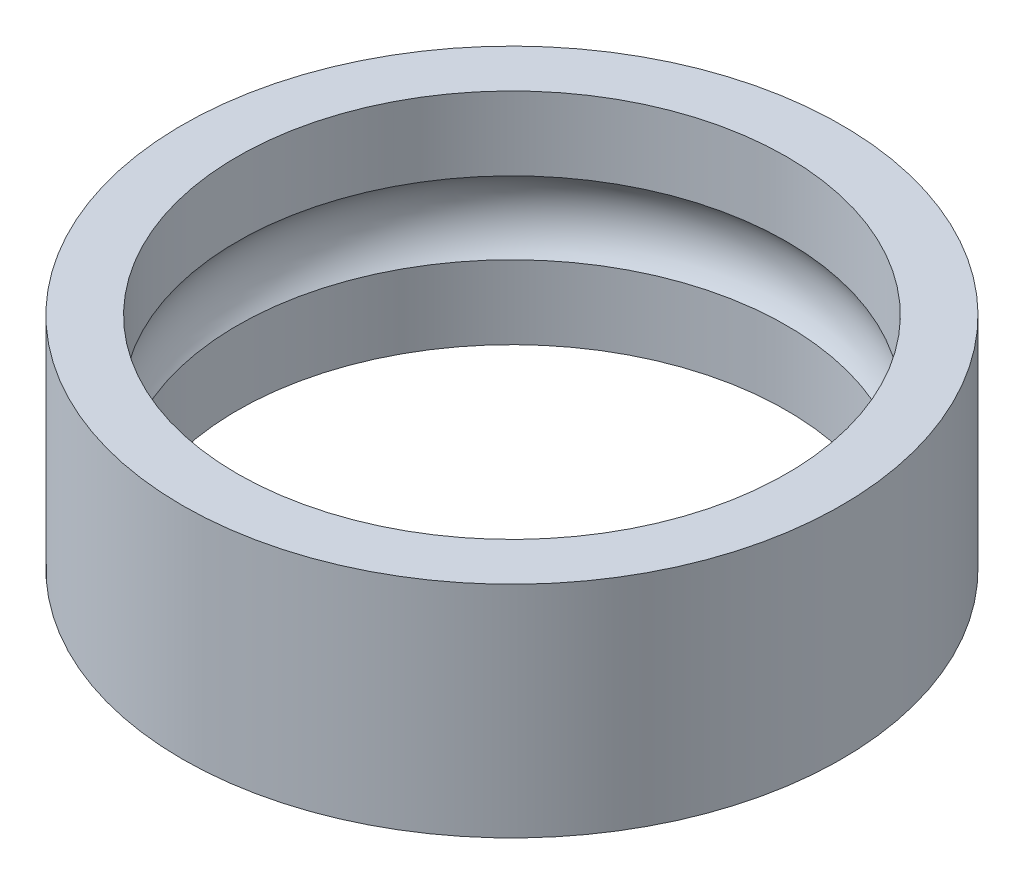
from build123d import *

# Parameters (mm, degrees)
DIAPROFILES_R         = 3
DIAPROFILES_R_2       = 2.5
DIAPROFILE_DEPTH      = 1
BEARINGPATHPROFILES_R = 0.5


with BuildPart() as part:
    # DiaProfileS → DiaProfile (new, symmetric)
    with BuildSketch(Plane(origin=(0, 0, 0), x_dir=(1, 0, 0), z_dir=(0, 1, 0))):
        Circle(DIAPROFILES_R)
        Circle(DIAPROFILES_R_2, mode=Mode.SUBTRACT)
    extrude(amount=DIAPROFILE_DEPTH, both=True)

    # BearingPathProfileS → BearingPathProfile (revolve, cut)
    with BuildSketch(Plane.XY):
        with Locations((2.125, 0)):
            Circle(BEARINGPATHPROFILES_R)
    revolve(axis=Axis((0, 1, 0), (0, -1, 0)), mode=Mode.SUBTRACT)


solid = part.part
